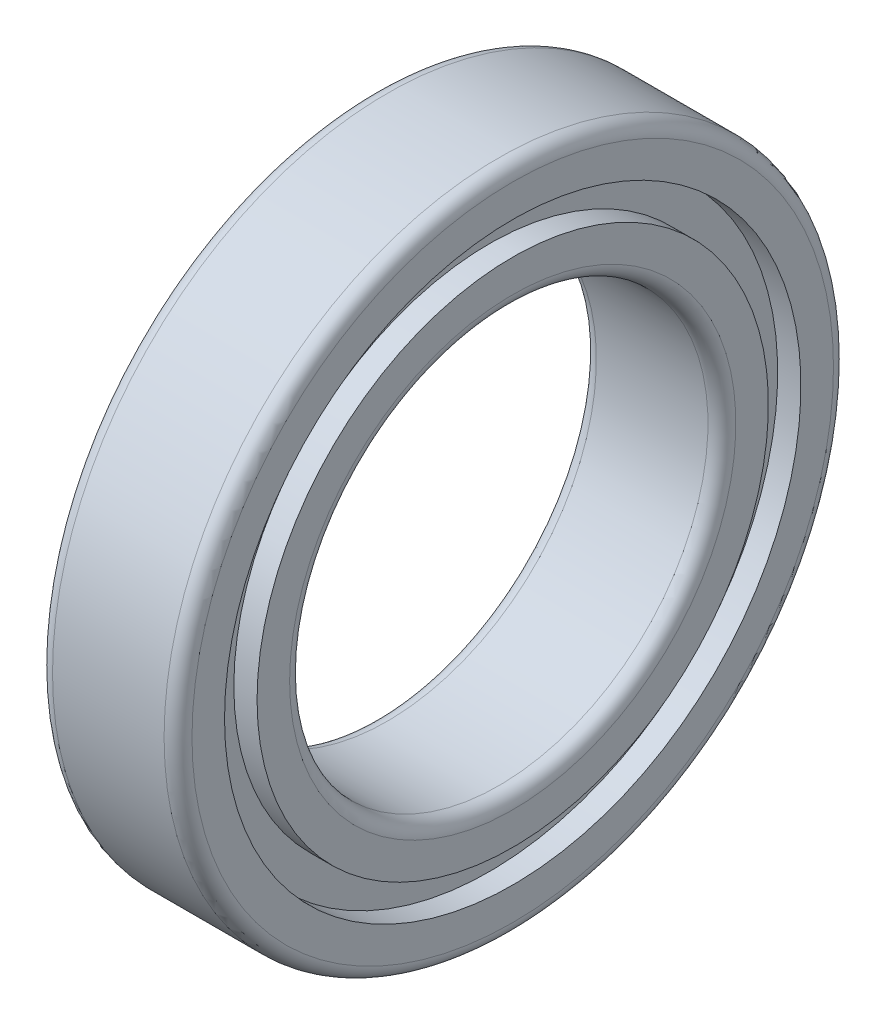
from build123d import *


with BuildPart() as part:
    # Эскиз1 → Повернуть1 (revolve)
    with BuildSketch(Plane.XY):
        with BuildLine():
            Line((2, 7.5), (-2, 7.5))
            ThreePointArc((-2, 7.5), (-2.353553391, 7.646446609), (-2.5, 8))
            Line((-2.5, 8), (-2.5, 9.166666667))
            Line((-2.5, 9.166666667), (-1.666666667, 9.166666667))
            Line((-1.666666667, 9.166666667), (-1.666666667, 10.333333333))
            Line((-1.666666667, 10.333333333), (-2.5, 10.333333333))
            Line((-2.5, 10.333333333), (-2.5, 11.5))
            ThreePointArc((-2.5, 11.5), (-2.353553391, 11.853553391), (-2, 12))
            Line((-2, 12), (2, 12))
            ThreePointArc((2, 12), (2.353553391, 11.853553391), (2.5, 11.5))
            Line((2.5, 11.5), (2.5, 10.333333333))
            Line((2.5, 10.333333333), (1.666666667, 10.333333333))
            Line((1.666666667, 10.333333333), (1.666666667, 9.166666667))
            Line((1.666666667, 9.166666667), (2.5, 9.166666667))
            Line((2.5, 9.166666667), (2.5, 8))
            ThreePointArc((2.5, 8), (2.353553391, 7.646446609), (2, 7.5))
        make_face()
    revolve(axis=Axis((-1000, 0, 0), (1, 0, 0)))


solid = part.part
